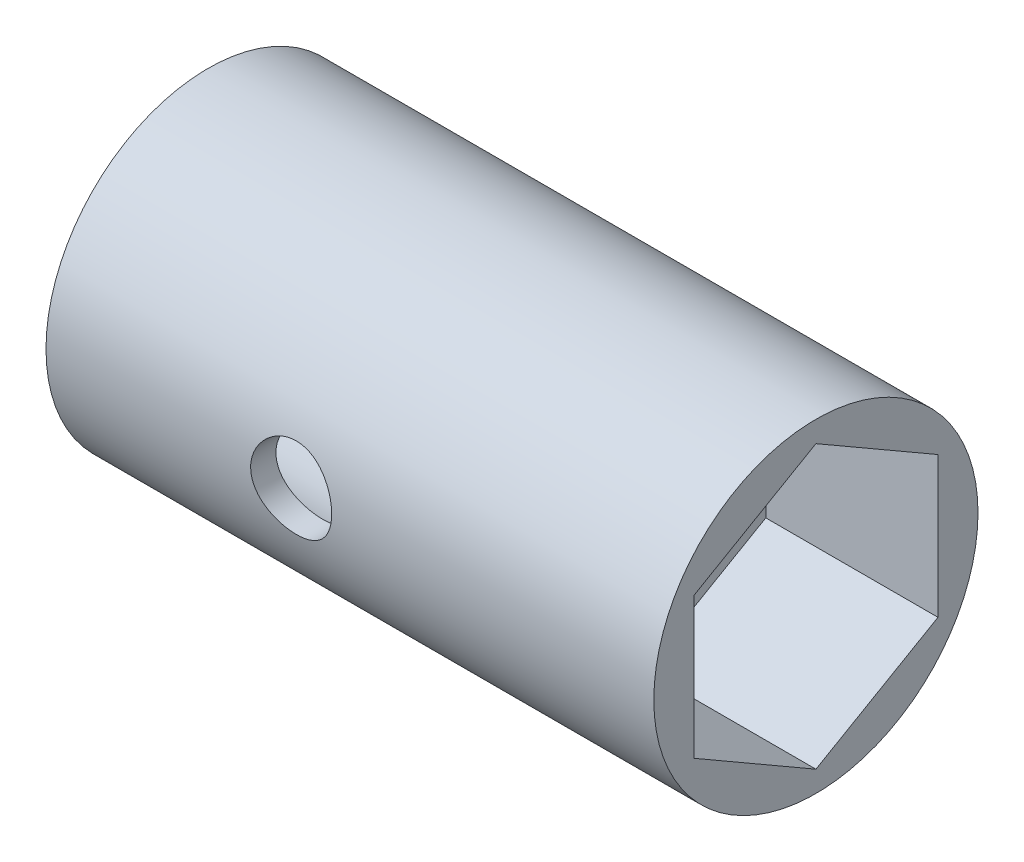
from build123d import *

# Parameters (mm, degrees)
CROQUIS1_R                 = 8
SALIENTE_EXTRUIR1_DEPTH    = 20
CORTAR_EXTRUIR1_DEPTH      = 8.5
CROQUIS3_R                 = 6.75
CORTAR_EXTRUIR2_DEPTH      = 9
CORTAR_EXTRUIR3_REACH      = 17.78
CROQUIS4_R                 = 2.025
CORTAR_EXTRUIR4_DEPTH      = 9
CORTAR_EXTRUIR4_DEPTH_BACK = 23.978250586
CROQUIS5_R                 = 2
SALIENTE_EXTRUIR2_START    = 10
CROQUIS6_R                 = 8
CROQUIS6_R_2               = 6.75
SALIENTE_EXTRUIR2_DEPTH    = 10


with BuildPart() as part:
    # Croquis1 → Saliente-Extruir1 (new body)
    with BuildSketch(Plane(origin=(0, 0, 0), x_dir=(0, 0, -1), z_dir=(1, 0, 0))):
        Circle(CROQUIS1_R)
    extrude(amount=SALIENTE_EXTRUIR1_DEPTH)

    # Croquis2 → Cortar-Extruir1 (cut)
    with BuildSketch(Plane(origin=(20, 0, 0), x_dir=(0, 0, -1), z_dir=(1, 0, 0))):
        Polygon((0, -6.957070744), (6.025, -3.478535372), (6.025, 3.478535372), (0, 6.957070744), (-6.025, 3.478535372), (-6.025, -3.478535372), align=None)
    extrude(amount=-CORTAR_EXTRUIR1_DEPTH, mode=Mode.SUBTRACT)

    # Croquis3 → Cortar-Extruir2 (cut)
    with BuildSketch(Plane.ZY):
        Circle(CROQUIS3_R)
    extrude(amount=-CORTAR_EXTRUIR2_DEPTH, mode=Mode.SUBTRACT)

    # Croquis4 → Cortar-Extruir3 (cut, up to next)
    with BuildSketch(Plane.ZY.offset(-9), mode=Mode.PRIVATE) as cortar_extruir3_sk1:
        Circle(CROQUIS4_R)
    cortar_extruir3_tool1 = extrude(cortar_extruir3_sk1.sketch, amount=-CORTAR_EXTRUIR3_REACH, mode=Mode.PRIVATE) & part.part
    add(cortar_extruir3_tool1.solids().sort_by_distance((9, 0, 0))[0], mode=Mode.SUBTRACT)

    # Croquis5 → Cortar-Extruir4 (cut, two sides: drawn at the far end of the back side and taken through both)
    with BuildSketch(Plane.XY.offset(-CORTAR_EXTRUIR4_DEPTH_BACK)):
        with Locations((2.1, 0)):
            Circle(CROQUIS5_R)
    extrude(amount=CORTAR_EXTRUIR4_DEPTH + CORTAR_EXTRUIR4_DEPTH_BACK, mode=Mode.SUBTRACT)

    # Croquis6 → Saliente-Extruir2 (add)
    with BuildSketch(Plane.ZY.offset(SALIENTE_EXTRUIR2_START)):
        Circle(CROQUIS6_R)
        Circle(CROQUIS6_R_2, mode=Mode.SUBTRACT)
    extrude(amount=-SALIENTE_EXTRUIR2_DEPTH)


solid = part.part
